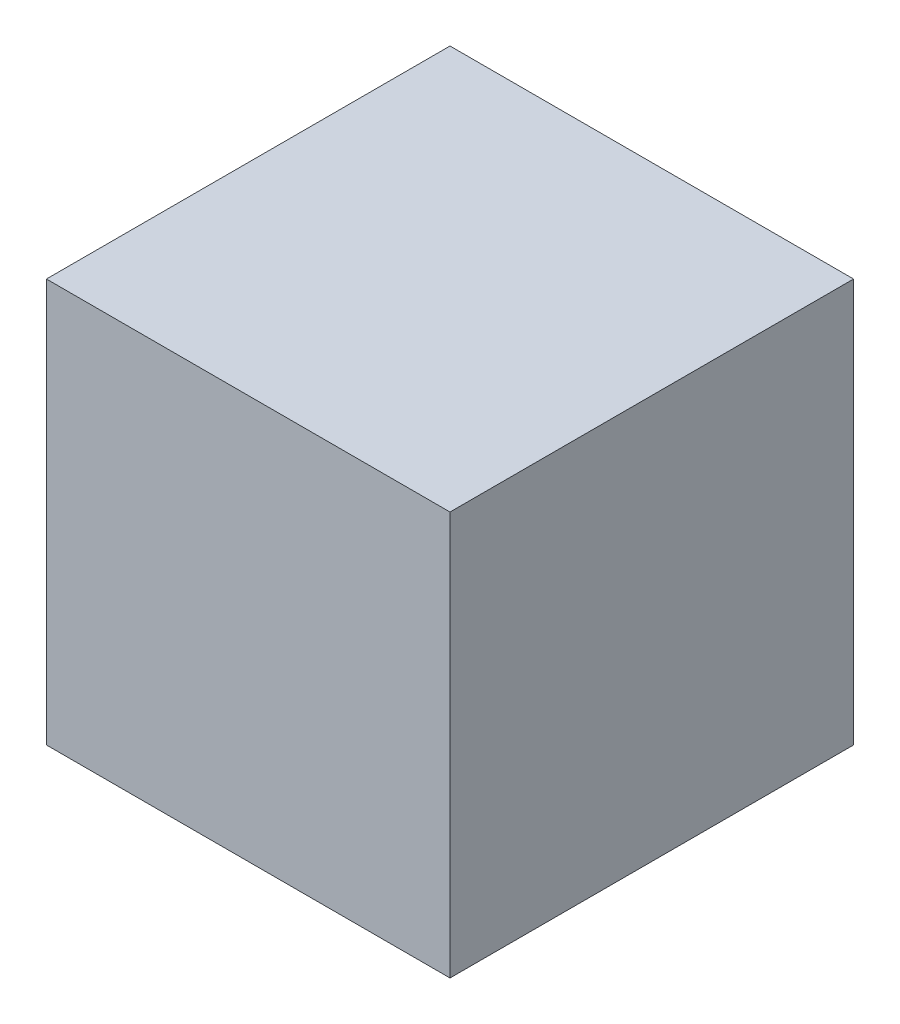
from build123d import *

# Parameters (mm, degrees)
CROQUIS3_W              = 100
CROQUIS3_H              = 100
SALIENTE_EXTRUIR1_DEPTH = 100


with BuildPart() as part:
    # Croquis3 → Saliente-Extruir1 (new body)
    with BuildSketch(Plane(origin=(0, 0, 0), x_dir=(1, 0, 0), z_dir=(0, 1, 0))):
        Rectangle(CROQUIS3_W, CROQUIS3_H)
    extrude(amount=SALIENTE_EXTRUIR1_DEPTH)


solid = part.part
